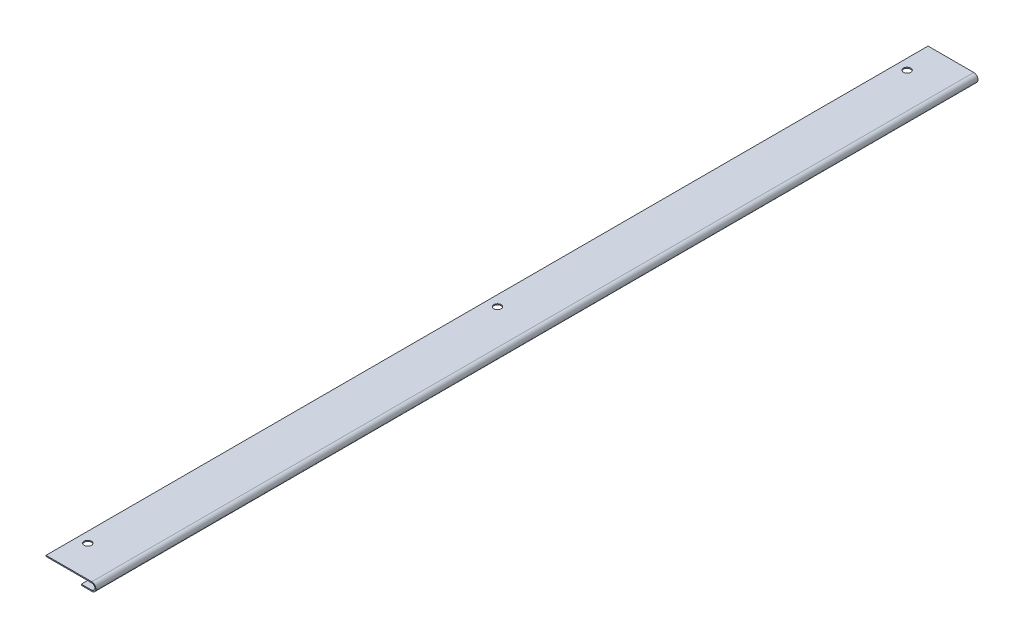
from build123d import *

# Parameters (mm, degrees)
BASE_FLANGE1_DEPTH = 211
SKETCH10_R         = 1.75
EXTRUDE2_DEPTH     = 10


# Sheet-metal steps are written as plain solids
with BuildPart() as part:
    # Sketch1 → Base-Flange1 (new, symmetric)
    with BuildSketch(Plane.XY):
        with BuildLine():
            Line((0, 0), (21.9, 0))
            ThreePointArc((21.9, 0), (23.9, -2), (21.9, -4))
            Line((21.9, -4), (16.9, -4))
            Line((16.9, -4), (16.9, -3.5))
            Line((16.9, -3.5), (21.9, -3.5))
            ThreePointArc((21.9, -3.5), (23.4, -2), (21.9, -0.5))
            Line((21.9, -0.5), (0, -0.5))
            Line((0, -0.5), (0, 0))
        make_face()
    extrude(amount=BASE_FLANGE1_DEPTH, both=True)

    # Sketch10 → Extrude2 (cut)
    with BuildSketch(Plane(origin=(0, 0, 0), x_dir=(1, 0, 0), z_dir=(0, 1, 0))):
        with Locations(Location((5, 0, 0), (0, 0, 270))):
            Circle(SKETCH10_R)
        with Locations(Location((5, 196, 0), (0, 0, 270))):
            Circle(SKETCH10_R)
        with Locations(Location((5, -196, 0), (0, 0, 270))):
            Circle(SKETCH10_R)
    extrude(amount=-EXTRUDE2_DEPTH, mode=Mode.SUBTRACT)


solid = part.part
